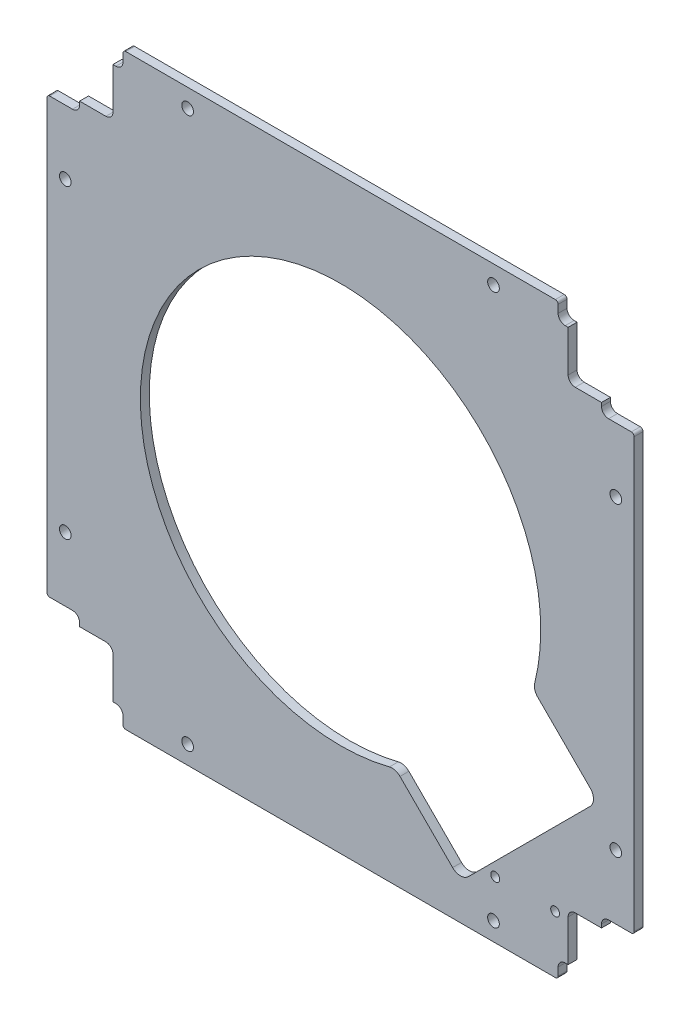
from build123d import *

# Parameters (mm, degrees)
SKETCH1_W                           = 106
SKETCH1_H                           = 106
MAINOUTLINE_DEPTH                   = 1.6
SKETCH4_W                           = 11.7
SKETCH4_H                           = 11.7
RAILCUTOUTS_DEPTH                   = 75.970394157
SKETCH13_W                          = 5.7
SKETCH13_H                          = 1.9
SKETCH13_W_2                        = 1.8
SKETCH13_H_2                        = 3
FILLETCUTOUTS_DEPTH                 = 75.970394157
SMOOTHCORNER_DEPTH                  = 10
MIRROR2_COPY_1_SKETCH_W             = 11.7
MIRROR2_COPY_1_SKETCH_H             = 11.7
MIRROR2_COPY_1_DEPTH                = 75.970394157
MIRROR2_COPY_2_SKETCH_W             = 5.7
MIRROR2_COPY_2_SKETCH_H             = 1.9
MIRROR2_COPY_2_SKETCH_W_2           = 1.8
MIRROR2_COPY_2_SKETCH_H_2           = 3
MIRROR2_COPY_2_DEPTH                = 75.970394157
MIRROR2_COPY_3_DEPTH                = 10
MIRROR2_COPY_4_SKETCH_W             = 11.7
MIRROR2_COPY_4_SKETCH_H             = 11.7
MIRROR2_COPY_4_DEPTH                = 75.970394157
MIRROR2_COPY_5_SKETCH_W             = 5.7
MIRROR2_COPY_5_SKETCH_H             = 1.9
MIRROR2_COPY_5_SKETCH_W_2           = 1.8
MIRROR2_COPY_5_SKETCH_H_2           = 3
MIRROR2_COPY_5_DEPTH                = 75.970394157
MIRROR2_COPY_6_DEPTH                = 10
M2_CLEARANCE_HOLE1_D                = 2.1
INTERBOARDCONNECTORHOLES_DEPTH      = 75.970394157
INTERBOARDCONNECTORHOLES_DEPTH_BACK = 75.970394157
SKETCH12_R                          = 0.8
CUT_EXTRUDE2_DEPTH                  = 75.970394157
CUT_EXTRUDE2_DEPTH_BACK             = 75.970394157
SKETCH11_R                          = 36
SKETCH15_W                          = 90
SKETCH15_H                          = 6.2
SKETCH15_W_2                        = 5.2
SKETCH15_H_2                        = 90
CUT_EXTRUDE5_DEPTH                  = 0.001
CUT_EXTRUDE11_DEPTH                 = 75.970394157
CUT_EXTRUDE11_DEPTH_BACK            = 75.970394157
FILLET4_R                           = 2
SKETCH24_OUTSIDE_W                  = 137.984
SKETCH24_OUTSIDE_H                  = 137.984
SKETCH24_OUTSIDE_W_2                = 105.6
SKETCH24_OUTSIDE_H_2                = 105.6
CUT_EXTRUDE19_DEPTH                 = 75.970394157
FILLET7_R                           = 0.5


with BuildPart() as part:
    # Sketch1 → mainOutline (new body)
    with BuildSketch(Plane.XY):
        Rectangle(SKETCH1_W, SKETCH1_H)
    extrude(amount=MAINOUTLINE_DEPTH)

    # Sketch4 → railCutouts (cut, through all)
    with BuildSketch(Plane(origin=(0, 0, 0), x_dir=(-1, 0, 0), z_dir=(0, 0, -1))):
        with Locations((47.15, 47.15)):
            Rectangle(SKETCH4_W, SKETCH4_H)
    railcutouts = extrude(amount=-RAILCUTOUTS_DEPTH, mode=Mode.SUBTRACT)

    # Sketch13 → filletCutouts (cut, symmetric)
    with BuildSketch(Plane(origin=(0, 0, 0), x_dir=(-1, 0, 0), z_dir=(0, 0, -1))):
        with Locations((50.15, 40.35)):
            Rectangle(SKETCH13_W, SKETCH13_H)
        with Locations((40.4, 51.5)):
            Rectangle(SKETCH13_W_2, SKETCH13_H_2)
    filletcutouts = extrude(amount=FILLETCUTOUTS_DEPTH, both=True, mode=Mode.SUBTRACT)

    # Sketch27 → smoothCorner (cut)
    with BuildSketch(Plane.XY.offset(1.6)):
        with BuildLine():
            Line((-40.928025612, 42.198025612), (-40.928025612, 49.628025612))
            Line((-40.928025612, 49.628025612), (-40.398025612, 49.628025612))
            ThreePointArc((-40.398025612, 49.628025612), (-39.5, 50), (-39.128025612, 50.898025612))
            Line((-39.128025612, 50.898025612), (-39.128025612, 53))
            Line((-39.128025612, 53), (-53, 53))
            Line((-53, 53), (-53, 39.028025612))
            Line((-53, 39.028025612), (-48.198025612, 39.028025612))
            ThreePointArc((-48.198025612, 39.028025612), (-47.3, 39.4), (-46.928025612, 40.298025612))
            Line((-46.928025612, 40.298025612), (-46.928025612, 40.928025612))
            Line((-46.928025612, 40.928025612), (-42.198025612, 40.928025612))
            ThreePointArc((-42.198025612, 40.928025612), (-41.3, 41.3), (-40.928025612, 42.198025612))
        make_face()
    smoothcorner = extrude(amount=-SMOOTHCORNER_DEPTH, mode=Mode.SUBTRACT)

    # Mirror1: railCutouts, filletCutouts, smoothCorner across plane
    add(railcutouts.mirror(Plane(origin=(0, 0, 0), x_dir=(0, 0, 1), z_dir=(1, 0, 0))), mode=Mode.SUBTRACT)
    add(filletcutouts.mirror(Plane(origin=(0, 0, 0), x_dir=(0, 0, 1), z_dir=(1, 0, 0))), mode=Mode.SUBTRACT)
    add(smoothcorner.mirror(Plane(origin=(0, 0, 0), x_dir=(0, 0, 1), z_dir=(1, 0, 0))), mode=Mode.SUBTRACT)

    # Mirror2 copy 1 sketch → Mirror2 copy 1 (cut, through all)
    with BuildSketch(Plane(origin=(0, 0, 0), x_dir=(1, 0, 0), z_dir=(0, 0, -1))):
        with Locations((47.15, 47.15)):
            Rectangle(MIRROR2_COPY_1_SKETCH_W, MIRROR2_COPY_1_SKETCH_H)
    extrude(amount=-MIRROR2_COPY_1_DEPTH, mode=Mode.SUBTRACT)

    # Mirror2 copy 2 sketch → Mirror2 copy 2 (cut, symmetric)
    with BuildSketch(Plane(origin=(0, 0, 0), x_dir=(1, 0, 0), z_dir=(0, 0, -1))):
        with Locations((50.15, 40.35)):
            Rectangle(MIRROR2_COPY_2_SKETCH_W, MIRROR2_COPY_2_SKETCH_H)
        with Locations((40.4, 51.5)):
            Rectangle(MIRROR2_COPY_2_SKETCH_W_2, MIRROR2_COPY_2_SKETCH_H_2)
    extrude(amount=MIRROR2_COPY_2_DEPTH, both=True, mode=Mode.SUBTRACT)

    # Mirror2 copy 3 sketch → Mirror2 copy 3 (cut)
    with BuildSketch(Plane(origin=(0, 0, 1.6), x_dir=(-1, 0, 0), z_dir=(0, 0, 1))):
        with BuildLine():
            Line((-40.928025612, 42.198025612), (-40.928025612, 49.628025612))
            Line((-40.928025612, 49.628025612), (-40.398025612, 49.628025612))
            ThreePointArc((-40.398025612, 49.628025612), (-39.5, 50), (-39.128025612, 50.898025612))
            Line((-39.128025612, 50.898025612), (-39.128025612, 53))
            Line((-39.128025612, 53), (-53, 53))
            Line((-53, 53), (-53, 39.028025612))
            Line((-53, 39.028025612), (-48.198025612, 39.028025612))
            ThreePointArc((-48.198025612, 39.028025612), (-47.3, 39.4), (-46.928025612, 40.298025612))
            Line((-46.928025612, 40.298025612), (-46.928025612, 40.928025612))
            Line((-46.928025612, 40.928025612), (-42.198025612, 40.928025612))
            ThreePointArc((-42.198025612, 40.928025612), (-41.3, 41.3), (-40.928025612, 42.198025612))
        make_face()
    extrude(amount=-MIRROR2_COPY_3_DEPTH, mode=Mode.SUBTRACT)

    # Mirror2 copy 4 sketch → Mirror2 copy 4 (cut, through all)
    with BuildSketch(Plane(origin=(0, 0, 0), x_dir=(-1, 0, 0), z_dir=(0, 0, -1))):
        with Locations((47.15, -47.15)):
            Rectangle(MIRROR2_COPY_4_SKETCH_W, MIRROR2_COPY_4_SKETCH_H)
    extrude(amount=-MIRROR2_COPY_4_DEPTH, mode=Mode.SUBTRACT)

    # Mirror2 copy 5 sketch → Mirror2 copy 5 (cut, symmetric)
    with BuildSketch(Plane(origin=(0, 0, 0), x_dir=(-1, 0, 0), z_dir=(0, 0, -1))):
        with Locations((50.15, -40.35)):
            Rectangle(MIRROR2_COPY_5_SKETCH_W, MIRROR2_COPY_5_SKETCH_H)
        with Locations((40.4, -51.5)):
            Rectangle(MIRROR2_COPY_5_SKETCH_W_2, MIRROR2_COPY_5_SKETCH_H_2)
    extrude(amount=MIRROR2_COPY_5_DEPTH, both=True, mode=Mode.SUBTRACT)

    # Mirror2 copy 6 sketch → Mirror2 copy 6 (cut)
    with BuildSketch(Plane.XY.offset(1.6)):
        with BuildLine():
            Line((-40.928025612, -42.198025612), (-40.928025612, -49.628025612))
            Line((-40.928025612, -49.628025612), (-40.398025612, -49.628025612))
            ThreePointArc((-40.398025612, -49.628025612), (-39.5, -50), (-39.128025612, -50.898025612))
            Line((-39.128025612, -50.898025612), (-39.128025612, -53))
            Line((-39.128025612, -53), (-53, -53))
            Line((-53, -53), (-53, -39.028025612))
            Line((-53, -39.028025612), (-48.198025612, -39.028025612))
            ThreePointArc((-48.198025612, -39.028025612), (-47.3, -39.4), (-46.928025612, -40.298025612))
            Line((-46.928025612, -40.298025612), (-46.928025612, -40.928025612))
            Line((-46.928025612, -40.928025612), (-42.198025612, -40.928025612))
            ThreePointArc((-42.198025612, -40.928025612), (-41.3, -41.3), (-40.928025612, -42.198025612))
        make_face()
    extrude(amount=-MIRROR2_COPY_6_DEPTH, mode=Mode.SUBTRACT)

    # M2 Clearance Hole1 (through all)
    with Locations(Plane(origin=(0, 0, 0), x_dir=(-1, 0, 0), z_dir=(0, 0, -1))):
        with Locations((49.5, -27.5), (27.5, -49.5), (-49.5, -27.5), (-27.5, -49.5), (-27.5, 49.5), (-49.5, 27.5), (27.5, 49.5), (49.5, 27.5)):
            Hole(M2_CLEARANCE_HOLE1_D / 2)

    # Sketch12 → interboardConnectorHoles (cut, two sides: drawn at the far end of the back side and taken through both)
    with BuildSketch(Plane.XY.offset(1.6).offset(-INTERBOARDCONNECTORHOLES_DEPTH_BACK)):
        with Locations((27.815, -42.5)):
            Circle(SKETCH12_R)
        with Locations((38.585, -42.5)):
            Circle(SKETCH12_R)
    extrude(amount=INTERBOARDCONNECTORHOLES_DEPTH + INTERBOARDCONNECTORHOLES_DEPTH_BACK, mode=Mode.SUBTRACT)

    # Sketch11 → Cut-Extrude2 (cut, two sides: drawn at the far end of the back side and taken through both)
    with BuildSketch(Plane(origin=(0, 0, 0), x_dir=(-1, 0, 0), z_dir=(0, 0, -1)).offset(-CUT_EXTRUDE2_DEPTH_BACK)):
        Circle(SKETCH11_R)
    extrude(amount=CUT_EXTRUDE2_DEPTH + CUT_EXTRUDE2_DEPTH_BACK, mode=Mode.SUBTRACT)

    # Sketch15 → Cut-Extrude5 (cut)
    with BuildSketch(Plane(origin=(0, 0, 0), x_dir=(-1, 0, 0), z_dir=(0, 0, -1))):
        with Locations((0, 49.9)):
            Rectangle(SKETCH15_W, SKETCH15_H)
        with Locations((0, -49.9)):
            Rectangle(SKETCH15_W, SKETCH15_H)
        with Locations((-50.4, 0)):
            Rectangle(SKETCH15_W_2, SKETCH15_H_2)
        with Locations((50.4, 0)):
            Rectangle(SKETCH15_W_2, SKETCH15_H_2)
    extrude(amount=-CUT_EXTRUDE5_DEPTH, mode=Mode.SUBTRACT)

    # Sketch22 → Cut-Extrude11 (cut, two sides: drawn at the far end of the back side and taken through both)
    with BuildSketch(Plane.XY.offset(1.6).offset(-CUT_EXTRUDE11_DEPTH_BACK)):
        Polygon((21.566756826, -46.315494168), (46.315494168, -21.566756826), (12.374368671, 12.374368671), (-12.374368671, -12.374368671), align=None)
    extrude(amount=CUT_EXTRUDE11_DEPTH + CUT_EXTRUDE11_DEPTH_BACK, mode=Mode.SUBTRACT)

    # Fillet4
    fillet4_edges = [part.edges().sort_by_distance(p)[0] for p in [
        (21.566756826, -46.315494168, 0.8),
        (46.315494168, -21.566756826, 0.8),
        (34.620154789, -9.871417447, 0.8),
        (9.871417447, -34.620154789, 0.8),
    ]]
    fillet(fillet4_edges, radius=FILLET4_R)

    # Sketch24 outside → Cut-Extrude19 (cut, through all)
    with BuildSketch(Plane.XY.offset(1.6)):
        Rectangle(SKETCH24_OUTSIDE_W, SKETCH24_OUTSIDE_H)
        Rectangle(SKETCH24_OUTSIDE_W_2, SKETCH24_OUTSIDE_H_2, mode=Mode.SUBTRACT)
    extrude(amount=-CUT_EXTRUDE19_DEPTH, mode=Mode.SUBTRACT)

    # Fillet7
    fillet7_edges = [part.edges().sort_by_distance(p)[0] for p in [
        (-52.8, -39.028025612, 0.8005),
        (-39.128025612, -52.8, 0.8005),
        (39.128025612, -52.8, 0.8005),
        (52.8, -39.028025612, 0.8005),
        (52.8, 39.028025612, 0.8005),
        (39.128025612, 52.8, 0.8005),
        (-39.128025612, 52.8, 0.8005),
        (-52.8, 39.028025612, 0.8005),
    ]]
    fillet(fillet7_edges, radius=FILLET7_R)


solid = part.part
